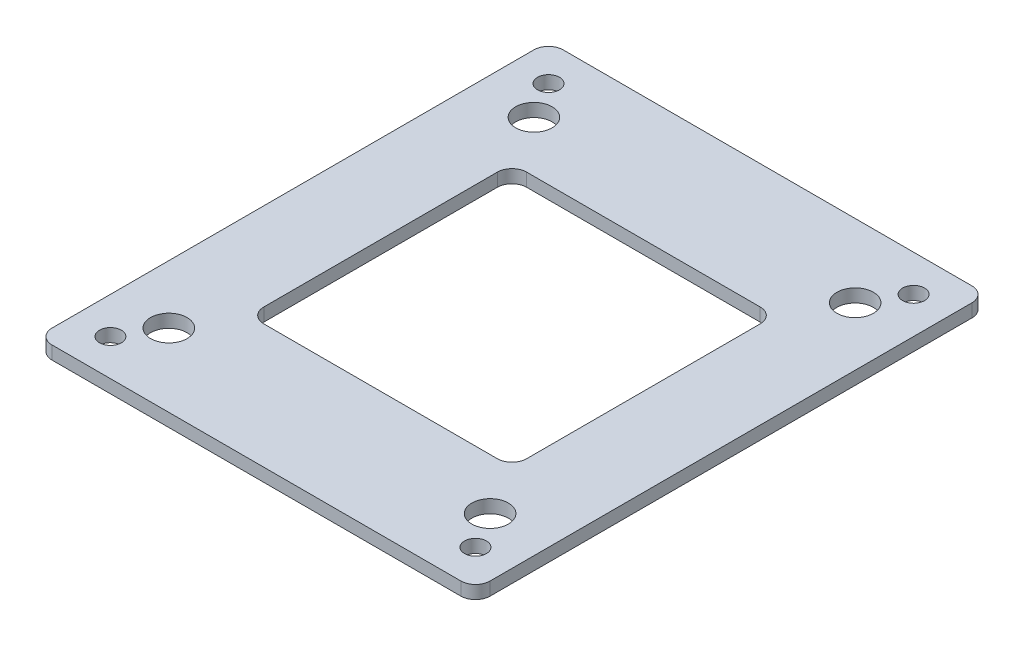
from build123d import *

# Parameters (mm, degrees)
SKETCH_1_W          = 60
SKETCH_1_H          = 70
SKETCH_1_R          = 2.5
EXTRUDE_1_DEPTH     = 1.8
SKETCH_2_R          = 1.5
SKETCH_2_W          = 36
SKETCH_2_H          = 36
CUT_EXTRUDE_1_DEPTH = 47.132851635
FILLET_1_R          = 2


with BuildPart() as part:
    # 草图1 → 凸台-拉伸1 (new body)
    with BuildSketch(Plane(origin=(0, 0, 0), x_dir=(1, 0, 0), z_dir=(0, 1, 0))):
        Rectangle(SKETCH_1_W, SKETCH_1_H)
        with Locations((-22, 25)):
            Circle(SKETCH_1_R, mode=Mode.SUBTRACT)
        with Locations((22, 25)):
            Circle(SKETCH_1_R, mode=Mode.SUBTRACT)
        with Locations((22, -25)):
            Circle(SKETCH_1_R, mode=Mode.SUBTRACT)
        with Locations((-22, -25)):
            Circle(SKETCH_1_R, mode=Mode.SUBTRACT)
    extrude(amount=EXTRUDE_1_DEPTH)

    # 草图2 → 切除-拉伸1 (cut, through all)
    with BuildSketch(Plane(origin=(0, 1.8, 0), x_dir=(1, 0, 0), z_dir=(0, 1, 0))):
        with Locations((-25, 30)):
            Circle(SKETCH_2_R)
        with Locations((25, 30)):
            Circle(SKETCH_2_R)
        with Locations((25, -30)):
            Circle(SKETCH_2_R)
        with Locations((-25, -30)):
            Circle(SKETCH_2_R)
        Rectangle(SKETCH_2_W, SKETCH_2_H)
    extrude(amount=-CUT_EXTRUDE_1_DEPTH, mode=Mode.SUBTRACT)

    # 圆角1
    fillet_1_edges = [part.edges().sort_by_distance(p)[0] for p in [
        (18, 0.9, -18),
        (-18, 0.9, -18),
        (18, 0.9, 18),
        (-18, 0.9, 18),
        (-30, 0.9, 35),
        (30, 0.9, 35),
        (30, 0.9, -35),
        (-30, 0.9, -35),
    ]]
    fillet(fillet_1_edges, radius=FILLET_1_R)


solid = part.part
